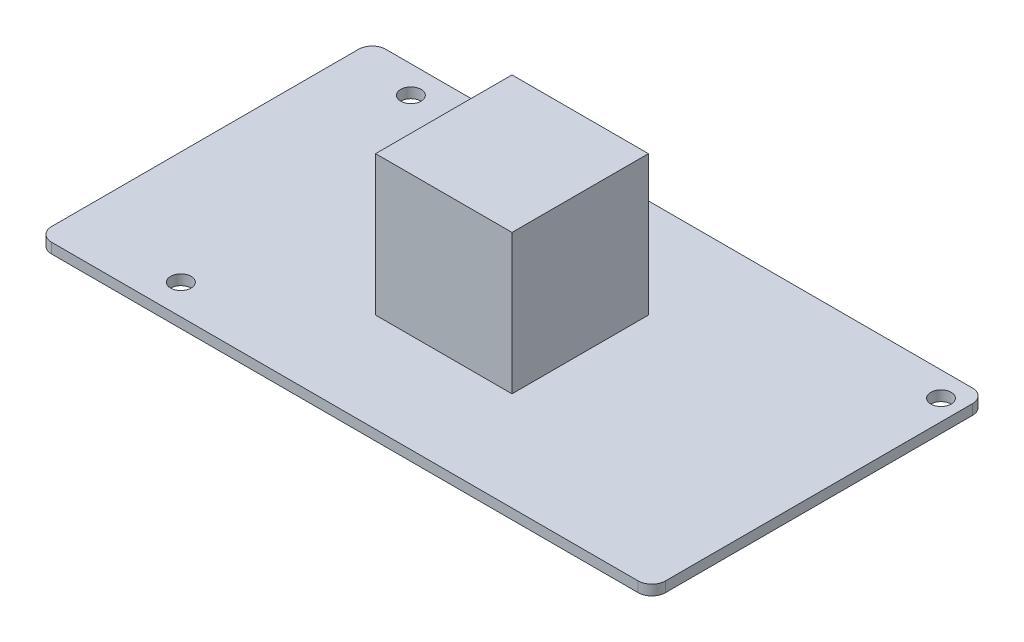
from build123d import *

# Parameters (mm, degrees)
SKETCH1_W             = 90
SKETCH1_H             = 49
BOSS_EXTRUDE1_DEPTH   = 1.5
FILLET1_R             = 2
F_1_0MM_DOWEL_HOLE1_D = 3
SKETCH4_W             = 20
SKETCH4_H             = 20
BOSS_EXTRUDE2_DEPTH   = 22


with BuildPart() as part:
    # Sketch1 → Boss-Extrude1 (new body)
    with BuildSketch(Plane(origin=(0, 0, 0), x_dir=(1, 0, 0), z_dir=(0, 1, 0))):
        Rectangle(SKETCH1_W, SKETCH1_H)
    extrude(amount=BOSS_EXTRUDE1_DEPTH)

    # Fillet1
    fillet1_edges = [part.edges().sort_by_distance(p)[0] for p in [
        (-45, 0.75, -24.5),
        (45, 0.75, -24.5),
        (45, 0.75, 24.5),
        (-45, 0.75, 24.5),
    ]]
    fillet(fillet1_edges, radius=FILLET1_R)

    # Ø1.0mm Dowel Hole1 (through all)
    with Locations(Plane(origin=(0, 1.5, 0), x_dir=(1, 0, 0), z_dir=(0, 1, 0))):
        with Locations((-35.325, 20.5), (42, 20.9), (-28.45, -20.1)):
            Hole(F_1_0MM_DOWEL_HOLE1_D / 2)

    # Sketch4 → Boss-Extrude2 (add)
    with BuildSketch(Plane.XZ):
        Rectangle(SKETCH4_W, SKETCH4_H)
    extrude(amount=-BOSS_EXTRUDE2_DEPTH)


solid = part.part
